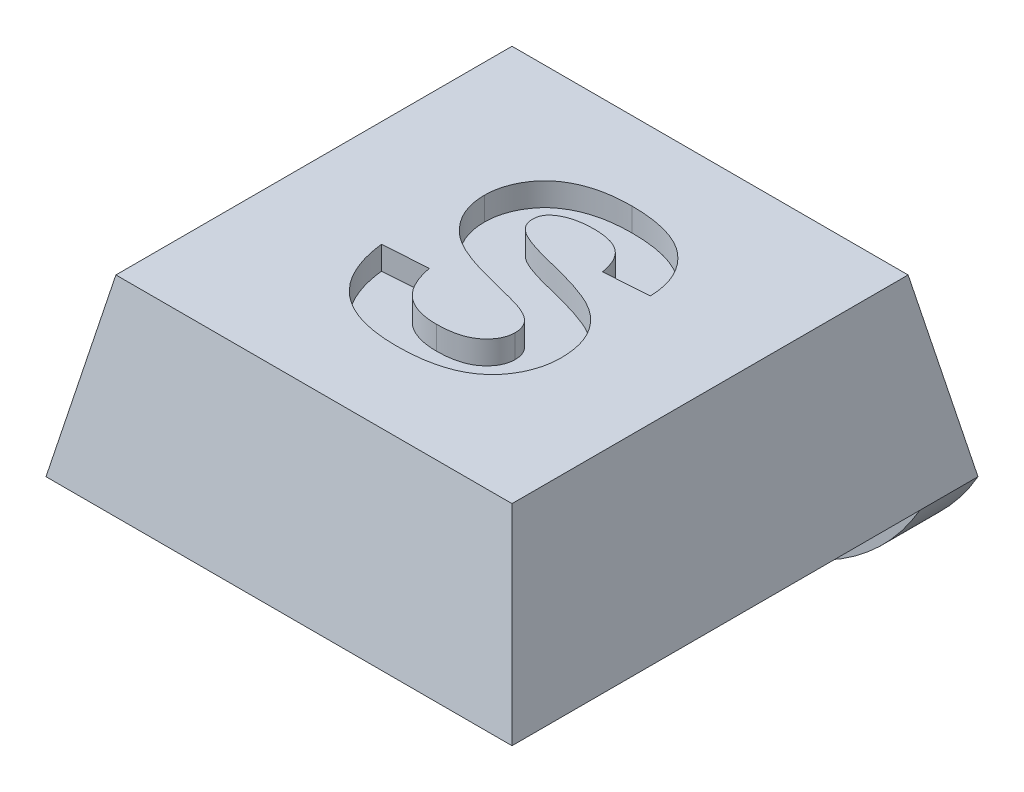
from build123d import *

# Parameters (mm, degrees)
SKETCH1_W               = 8
SKETCH1_H               = 8
BOSS_EXTRUDE1_DEPTH     = 3
CUT_EXTRUDE1_DEPTH      = 12.704699911
CUT_EXTRUDE1_DEPTH_BACK = 12.704699911
CUT_EXTRUDE2_DEPTH      = 11
SKETCH4_R               = 1.8
CUT_EXTRUDE3_DEPTH      = 0.8
SKETCH5_W               = 8
SKETCH5_H               = 1
BOSS_EXTRUDE2_DEPTH     = 2
FILLET1_R               = 4
CUT_EXTRUDE4_DEPTH      = 0.4


with BuildPart() as part:
    # Sketch1 → Boss-Extrude1 (new body)
    with BuildSketch(Plane(origin=(0, 0, 0), x_dir=(1, 0, 0), z_dir=(0, 1, 0))):
        with Locations((4, 4)):
            Rectangle(SKETCH1_W, SKETCH1_H)
    extrude(amount=BOSS_EXTRUDE1_DEPTH)

    # Sketch2 → Cut-Extrude1 (cut, two sides: drawn at the far end of the back side and taken through both)
    with BuildSketch(Plane.XY.offset(-CUT_EXTRUDE1_DEPTH_BACK)):
        Polygon((0, 0), (0.6, 3), (0, 3), align=None)
        Polygon((8, 0), (7.4, 3), (8, 3), align=None)
    extrude(amount=CUT_EXTRUDE1_DEPTH + CUT_EXTRUDE1_DEPTH_BACK, mode=Mode.SUBTRACT)

    # Sketch3 → Cut-Extrude2 (cut)
    with BuildSketch(Plane(origin=(0, 0, 0), x_dir=(0, 0, -1), z_dir=(1, 0, 0))):
        Polygon((0, 0), (0.6, 3), (0, 3), align=None)
        Polygon((8, 3), (7.4, 3), (8, 0), align=None)
    extrude(amount=CUT_EXTRUDE2_DEPTH, mode=Mode.SUBTRACT)

    # Sketch4 → Cut-Extrude3 (cut)
    with BuildSketch(Plane.XZ):
        with Locations(Location((4, -3.75, 0), (0, 0, 270))):
            Circle(SKETCH4_R)
    extrude(amount=-CUT_EXTRUDE3_DEPTH, mode=Mode.SUBTRACT)

    # Sketch5 → Boss-Extrude2 (add)
    with BuildSketch(Plane.XZ):
        with Locations((4, -7.5)):
            Rectangle(SKETCH5_W, SKETCH5_H)
    extrude(amount=BOSS_EXTRUDE2_DEPTH)

    # Fillet1
    # the kernel refuses this fillet: 4 mm, written as the material it takes off along each edge
    with BuildSketch(Plane(origin=(8, -2, -16.660254038), x_dir=(0, 1, 0), z_dir=(0, 0, 1)), Plane(origin=(0, -2, 1.660254038), x_dir=(0, 1, 0), z_dir=(0, 0, -1))) as fillet1_piece_1:
        with BuildLine():
            CenterArc((4, 3.464101615), FILLET1_R, 180, 60)
            Line((0, 3.464101615), (-0.08, 3.464101615))
            Line((-0.08, 3.464101615), (-0.08, 0))
            Line((-0.08, 0), (0, -0.08))
            ThreePointArc((0, -0.08), (1, -0.08), (1.96, -0.069282032))
            Line((1.96, -0.069282032), (2, 0))
        make_face()
    extrude(amount=18.320508076, mode=Mode.SUBTRACT)

    # Sketch6 → Cut-Extrude4 (cut)
    with BuildSketch(Plane(origin=(0, 3, 0), x_dir=(1, 0, 0), z_dir=(0, 1, 0))):
        with BuildLine():
            Line((2.423916505, 3.336189685), (3.193147274, 3.387471736))
            add(Edge.make_bspline(
                [(3.193147274, 3.387471736), (3.199275518, 3.35528983), (3.211179242, 3.292778523), (3.237627081, 3.203691377), (3.266738832, 3.12063689), (3.30152897, 3.044505684), (3.339615284, 2.973890515), (3.38412658, 2.910803039), (3.431957638, 2.853229033), (3.485476185, 2.803236311), (3.543783948, 2.759451994), (3.607171876, 2.722111271), (3.674953108, 2.6897922), (3.747293374, 2.663178469), (3.824938253, 2.64331119), (3.907211345, 2.629176798), (3.994230643, 2.620125524), (4.053701404, 2.618879435), (4.084172915, 2.618240967)],
                knots=[0, 0, 0, 0, 1.204560339, 2.339781841, 3.415289417, 4.440034832, 5.416475564, 6.362424008, 7.275913008, 8.16578645, 9.05021719, 9.95355393, 10.867835453, 11.809845306, 12.784702352, 13.812224031, 14.87903166, 16, 16, 16, 16], degree=3))
            add(Edge.make_bspline(
                [(4.084172915, 2.618240967), (4.116246108, 2.618590883), (4.178630121, 2.619271489), (4.269031453, 2.627715), (4.353560804, 2.639811238), (4.431471751, 2.6589593), (4.504219207, 2.680373377), (4.569996427, 2.709670116), (4.629867843, 2.743459668), (4.683679212, 2.781802056), (4.730640445, 2.824326515), (4.771724475, 2.86872067), (4.807505951, 2.914025405), (4.835668504, 2.962251146), (4.858460082, 3.011447443), (4.873523718, 3.063081907), (4.883700097, 3.1159689), (4.884867031, 3.152113555), (4.885454967, 3.1703243)],
                knots=[0, 0, 0, 0, 1.417779877, 2.757654889, 4.012140507, 5.189587551, 6.302846416, 7.360586765, 8.365575446, 9.33904572, 10.275781718, 11.161696098, 12.012180333, 12.822428111, 13.625933072, 14.403138519, 15.195454004, 16, 16, 16, 16], degree=3))
            add(Edge.make_bspline(
                [(4.885454967, 3.1703243), (4.884733913, 3.193140887), (4.883323278, 3.237778199), (4.866340641, 3.301592127), (4.840872442, 3.360713887), (4.802526135, 3.41427025), (4.750979261, 3.463212961), (4.685226085, 3.508997669), (4.603431212, 3.550186), (4.542750055, 3.573160928), (4.510454967, 3.585388403)],
                knots=[0, 0, 0, 0, 0.90494901, 1.770400303, 2.607161909, 3.452839393, 4.36912122, 5.420987164, 6.627424851, 8, 8, 8, 8], degree=3))
            add(Edge.make_bspline(
                [(4.510454967, 3.585388403), (4.496597999, 3.590031937), (4.465588357, 3.600423411), (4.4126892, 3.615282239), (4.348970759, 3.633836968), (4.273512264, 3.654927379), (4.186339087, 3.676497317), (4.088424838, 3.703069034), (3.978575834, 3.729510064), (3.901725338, 3.749028827), (3.861416505, 3.759266608)],
                knots=[0, 0, 0, 0, 0.521821638, 1.167752076, 1.961721917, 2.891982557, 3.96540661, 5.168436773, 6.514817513, 8, 8, 8, 8], degree=3))
            add(Edge.make_bspline(
                [(3.861416505, 3.759266608), (3.808922441, 3.772373151), (3.707643728, 3.797660082), (3.563197092, 3.84264374), (3.430159098, 3.887337495), (3.309810688, 3.935832618), (3.200824367, 3.984842463), (3.104963023, 4.037807847), (3.02022624, 4.091978089), (2.970848149, 4.132466251), (2.947153685, 4.151894813)],
                knots=[0, 0, 0, 0, 1.293880989, 2.496331788, 3.617634808, 4.64976062, 5.598842568, 6.473791081, 7.267636666, 8, 8, 8, 8], degree=3))
            add(Edge.make_bspline(
                [(2.947153685, 4.151894813), (2.917769469, 4.179407128), (2.860158996, 4.233347566), (2.784323751, 4.321982057), (2.720601495, 4.415610216), (2.668151102, 4.513540942), (2.627765291, 4.616338017), (2.599140348, 4.723313361), (2.580613245, 4.834746169), (2.578722682, 4.91063455), (2.577762659, 4.949170454)],
                knots=[0, 0, 0, 0, 1.064429417, 2.086912298, 3.078678339, 4.055528992, 5.020032834, 5.993708893, 6.981211098, 8, 8, 8, 8], degree=3))
            add(Edge.make_bspline(
                [(2.577762659, 4.949170454), (2.579632311, 4.999035454), (2.583341142, 5.097952729), (2.617353538, 5.24334762), (2.670335558, 5.383642492), (2.731782138, 5.495041815), (2.790819043, 5.579315825), (2.839844896, 5.639790083), (2.893704531, 5.696388175), (2.953135712, 5.747729494), (3.015931612, 5.796821395), (3.084525186, 5.840415592), (3.156971597, 5.881478913), (3.261809808, 5.93015757), (3.404151332, 5.980885512), (3.589345301, 6.023645948), (3.790984862, 6.049350493), (3.930782191, 6.052503897), (4.003243428, 6.054138403)],
                knots=[0, 0, 0, 0, 1.180131776, 2.341029169, 3.518901375, 4.725685298, 5.343762192, 5.955650671, 6.568945152, 7.192346361, 7.815201106, 8.455999361, 9.116257477, 9.787318263, 11.192748436, 12.688084276, 14.283332633, 16, 16, 16, 16], degree=3))
            add(Edge.make_bspline(
                [(4.003243428, 6.054138403), (4.062574751, 6.053344994), (4.177972905, 6.051801831), (4.345255933, 6.036197125), (4.501507358, 6.011910245), (4.646178875, 5.977046542), (4.779337891, 5.930982439), (4.901500568, 5.876111383), (5.012563098, 5.81096567), (5.111173405, 5.735171454), (5.199025737, 5.651613191), (5.275662846, 5.560343317), (5.341377732, 5.462514514), (5.396594511, 5.358198276), (5.439956101, 5.246858263), (5.471803478, 5.128633406), (5.492867609, 5.003801978), (5.498147397, 4.918266237), (5.500839582, 4.874651223)],
                knots=[0, 0, 0, 0, 1.325124071, 2.577337985, 3.749592149, 4.855247722, 5.896868755, 6.892903601, 7.842551483, 8.766257401, 9.665194363, 10.546067736, 11.423174165, 12.293291263, 13.177512979, 14.086532529, 15.024315359, 16, 16, 16, 16], degree=3))
            Line((5.500839582, 4.874651223), (4.731608813, 4.823369172))
            add(Edge.make_bspline(
                [(4.731608813, 4.823369172), (4.727171315, 4.847490186), (4.718523093, 4.894499533), (4.699719489, 4.96182647), (4.678509937, 5.024096207), (4.653685255, 5.081308344), (4.623700039, 5.13243816), (4.591067506, 5.179094223), (4.554887475, 5.220654869), (4.51396201, 5.255982033), (4.469697485, 5.288128305), (4.419251527, 5.313894286), (4.364737876, 5.337799444), (4.30408262, 5.355770261), (4.238450559, 5.370025359), (4.167803464, 5.380593162), (4.091994892, 5.385752959), (4.039841388, 5.386885694), (4.012858813, 5.387471736)],
                knots=[0, 0, 0, 0, 1.151066407, 2.24330871, 3.278475654, 4.238599069, 5.165719782, 6.056502506, 6.909492653, 7.744782051, 8.590364415, 9.471203867, 10.39832458, 11.382154319, 12.435022857, 13.550631277, 14.73277401, 16, 16, 16, 16], degree=3))
            add(Edge.make_bspline(
                [(4.012858813, 5.387471736), (3.984804304, 5.386954358), (3.930223002, 5.385947775), (3.850683499, 5.379770524), (3.776069477, 5.368367912), (3.706014485, 5.353524542), (3.640612102, 5.333331162), (3.580000346, 5.308708643), (3.523901913, 5.279720359), (3.489695535, 5.256913378), (3.47279471, 5.245644813)],
                knots=[0, 0, 0, 0, 1.186678824, 2.308736671, 3.37120409, 4.377216403, 5.334874112, 6.262130804, 7.141346615, 8, 8, 8, 8], degree=3))
            add(Edge.make_bspline(
                [(3.47279471, 5.245644813), (3.453453136, 5.230251633), (3.415994509, 5.200439822), (3.3756811, 5.141243702), (3.351412335, 5.074383458), (3.348491314, 5.027102037), (3.346993428, 5.002856352)],
                knots=[0, 0, 0, 0, 1.037857257, 2.010007357, 2.979541333, 4, 4, 4, 4], degree=3))
            add(Edge.make_bspline(
                [(3.346993428, 5.002856352), (3.348218426, 4.980197149), (3.350631475, 4.935562125), (3.374970191, 4.872157107), (3.41239982, 4.813407798), (3.447371668, 4.781494404), (3.465583172, 4.764875582)],
                knots=[0, 0, 0, 0, 0.98538058, 1.941042925, 2.927803204, 4, 4, 4, 4], degree=3))
            add(Edge.make_bspline(
                [(3.465583172, 4.764875582), (3.480036346, 4.754089134), (3.512333176, 4.72998591), (3.571494566, 4.699348433), (3.642903916, 4.666166195), (3.728189187, 4.633726893), (3.826783574, 4.601347807), (3.938693075, 4.567540299), (4.063986517, 4.533278892), (4.199470233, 4.500098399), (4.337024364, 4.467483879), (4.46828848, 4.431827004), (4.590345232, 4.397064309), (4.702628677, 4.360627363), (4.805717615, 4.325156109), (4.899111277, 4.288724577), (4.98345094, 4.253244341), (5.081800337, 4.204456503), (5.193269487, 4.138371404), (5.310101731, 4.042305693), (5.413424942, 3.934321559), (5.485417809, 3.83249997), (5.534873142, 3.744930694), (5.566717158, 3.675127784), (5.59426473, 3.601573118), (5.616688379, 3.524185412), (5.632940128, 3.442855773), (5.646389397, 3.358205559), (5.653260877, 3.269531733), (5.654205671, 3.209062493), (5.654685736, 3.178337121)],
                knots=[0, 0, 0, 0, 0.511875881, 1.143829537, 1.88775736, 2.750598373, 3.734912702, 4.837306479, 6.073130119, 7.42648979, 8.801963576, 10.091065733, 11.292408984, 12.408830014, 13.446061236, 14.39066453, 15.257936293, 16.045629259, 17.510392066, 18.929669597, 20.331293837, 21.746891395, 22.460690638, 23.187651344, 23.925159671, 24.69163991, 25.474819891, 26.281170188, 27.126635539, 28, 28, 28, 28], degree=3))
            add(Edge.make_bspline(
                [(5.654685736, 3.178337121), (5.654025632, 3.150001459), (5.652714728, 3.093729578), (5.643553782, 3.010207902), (5.629386607, 2.928169417), (5.608414322, 2.847511277), (5.580592445, 2.768392154), (5.549267222, 2.689670139), (5.510096795, 2.613061996), (5.465515506, 2.538504273), (5.41634032, 2.466052922), (5.360615699, 2.3992182), (5.301614691, 2.335770341), (5.235567289, 2.279262071), (5.166552067, 2.225117883), (5.091412341, 2.177166881), (5.011908526, 2.133775469), (4.927537931, 2.095267608), (4.838001417, 2.061711489), (4.743415274, 2.031844209), (4.642927337, 2.007400135), (4.537375532, 1.986448484), (4.426373586, 1.970515295), (4.310060277, 1.959390224), (4.188409162, 1.953116354), (4.105547428, 1.952094705), (4.063339582, 1.9515743)],
                knots=[0, 0, 0, 0, 0.900570041, 1.788444861, 2.667795364, 3.545012114, 4.433698372, 5.332345486, 6.235991676, 7.164928091, 8.092777575, 9.015680987, 9.928493428, 10.842962589, 11.775229507, 12.714851019, 13.672254427, 14.652424454, 15.660007982, 16.709910502, 17.803296389, 18.945495772, 20.129342395, 21.366102753, 22.658353839, 24, 24, 24, 24], degree=3))
            add(Edge.make_bspline(
                [(4.063339582, 1.9515743), (4.002397965, 1.952569276), (3.883743193, 1.954506517), (3.711359118, 1.971846347), (3.549674268, 1.998386209), (3.398951853, 2.0369045), (3.259007654, 2.086353292), (3.129905498, 2.147263285), (3.012269836, 2.219998383), (2.90464369, 2.302794639), (2.808461007, 2.397160809), (2.721973345, 2.501141662), (2.646347447, 2.615673526), (2.58163302, 2.740577261), (2.526193974, 2.875177636), (2.480472858, 3.01953646), (2.446047261, 3.174342245), (2.431421007, 3.281307488), (2.423916505, 3.336189685)],
                knots=[0, 0, 0, 0, 1.217954099, 2.371385517, 3.459848295, 4.490682126, 5.476952527, 6.422732854, 7.338496285, 8.236688651, 9.131557988, 10.026443255, 10.935708282, 11.869506048, 12.834296687, 13.842423496, 14.892981177, 16, 16, 16, 16], degree=3))
        make_face()
    extrude(amount=-CUT_EXTRUDE4_DEPTH, mode=Mode.SUBTRACT)


solid = part.part
